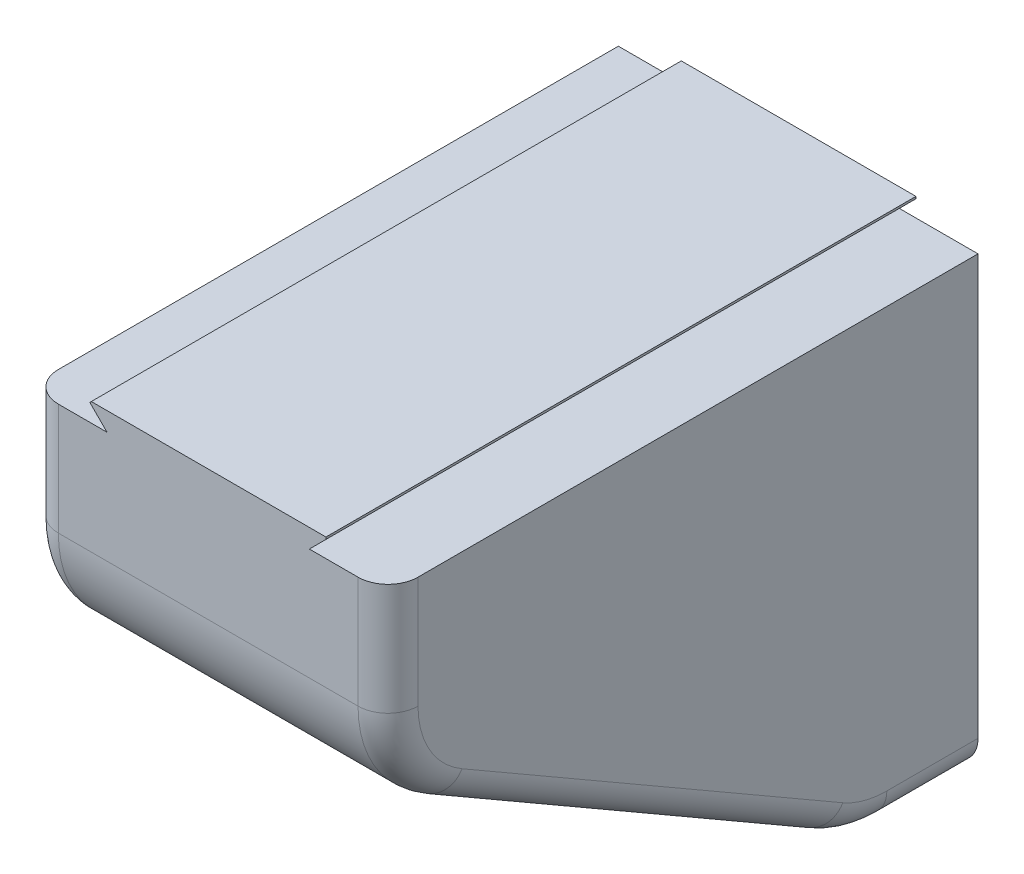
from build123d import *

# Parameters (mm, degrees)
EXTRUDE1_DEPTH  = 152.4
EXTRUDE2_DEPTH  = 500
CHAMFER1_SIZE   = 1.796051224
CHAMFER1_SIZE_2 = 2.54
FILLET1_R       = 100
FILLET2_R       = 25.4


with BuildPart() as part:
    # Sketch1 → Extrude1 (new, symmetric)
    with BuildSketch(Plane(origin=(0, 0, 0), x_dir=(0, 0, -1), z_dir=(1, 0, 0))):
        Polygon((0, 0), (-500, 0), (-500, -152.4), (-104.05318539, -381), (0, -381), align=None)
    extrude(amount=EXTRUDE1_DEPTH, both=True)

    # Sketch2 → Extrude2 (add, through all)
    with BuildSketch(Plane(origin=(0, 0, 0), x_dir=(-1, 0, 0), z_dir=(0, 0, -1))):
        Polygon((-85.725, 0), (-101.6, 15.875), (101.6, 15.875), (85.725, 0), align=None)
    extrude(amount=-EXTRUDE2_DEPTH)

    # Chamfer1
    # the kernel refuses this chamfer: 2.54, 1.796051224 mm, written as the material it takes off along each edge
    with BuildSketch(Plane(origin=(-101.6, 15.875, -6.532074789), x_dir=(0.6660419652145836, -0.7459142715976788, 0), z_dir=(0, 0, 1)), Plane(origin=(101.6, 15.875, -6.532074789), x_dir=(-0.9984038297885897, 0.056478249472489896, 0), z_dir=(0, 0, 1))) as chamfer1_piece_1:
        Polygon((CHAMFER1_SIZE * 0.998403829907, CHAMFER1_SIZE * 0.0564782494792), (CHAMFER1_SIZE_2 * 0.666041965215, CHAMFER1_SIZE_2 * 0.745914271598), (0, 0), align=None)
    extrude(amount=513.064149579, mode=Mode.SUBTRACT)

    # Fillet1
    fillet1_edges = [part.edges().sort_by_distance(p)[0] for p in [
        (0, -381, 104.05318539),
        (0, -152.4, 500),
    ]]
    fillet(fillet1_edges, radius=FILLET1_R)

    # Fillet2
    fillet2_edges = [part.edges().sort_by_distance(p)[0] for p in [
        (-152.4, -381, 38.629133073),
        (-152.4, -377.592582629, 103.140170657),
        (-152.4, -274.435026919, 288.629133073),
        (-152.4, -144.664973081, 486.602540378),
        (152.4, -381, 38.629133073),
        (152.4, -377.592582629, 103.140170657),
        (152.4, -274.435026919, 288.629133073),
        (152.4, -144.664973081, 486.602540378),
        (-152.4, -47.332486541, 500),
        (152.4, -47.332486541, 500),
    ]]
    fillet(fillet2_edges, radius=FILLET2_R)


solid = part.part
